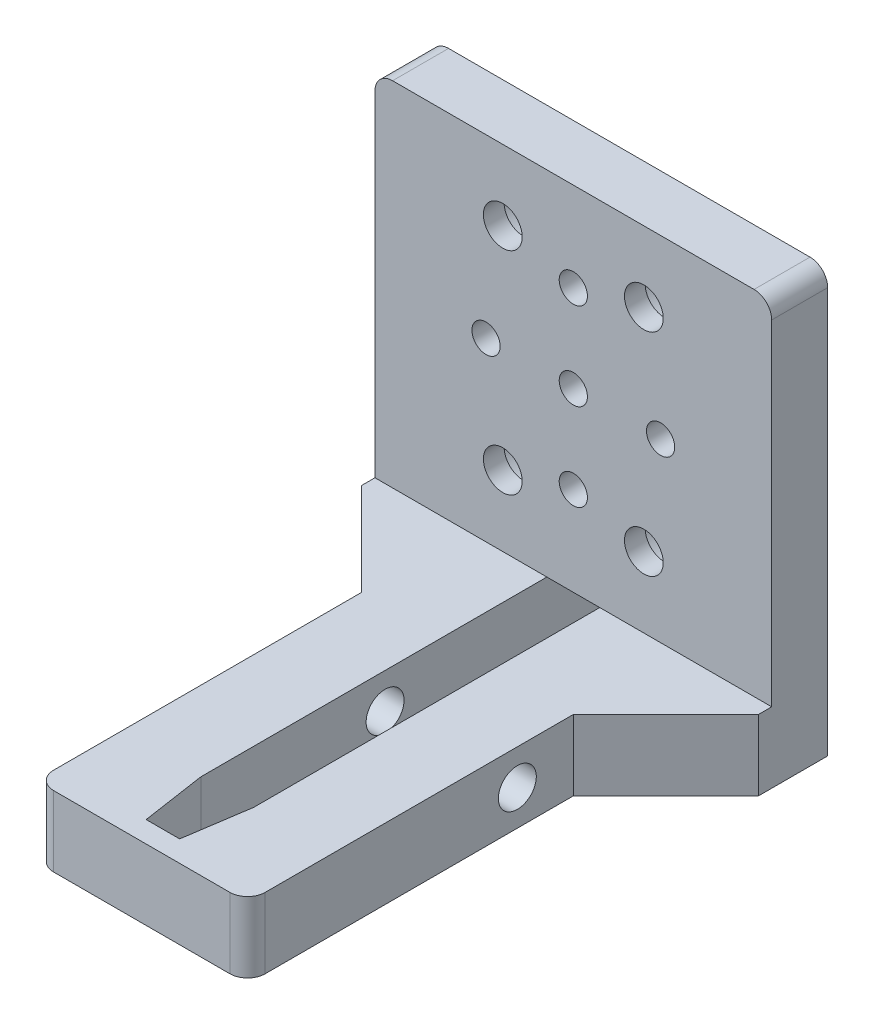
from build123d import *

# Parameters (mm, degrees)
SKETCH1_W                      = 22.5
SKETCH1_H                      = 20
BOSS_EXTRUDE1_DEPTH            = 3.175
TAP_DRILL_FOR_M2X0_4_TAP2_D    = 1.6
BOSS_EXTRUDE2_DEPTH            = 4
CHAMFER1_SIZE                  = 6
M2_CLEARANCE_HOLE1_D           = 2.15
FILLET1_R                      = 1
CBORE_FOR_M2_SHCS1_D           = 2.2
CBORE_FOR_M2_SHCS1_CBORE_D     = 4.4
CBORE_FOR_M2_SHCS1_CBORE_DEPTH = 2


with BuildPart() as part:
    # Sketch1 → Boss-Extrude1 (new body)
    with BuildSketch(Plane.XY):
        Rectangle(SKETCH1_W, SKETCH1_H)
    extrude(amount=BOSS_EXTRUDE1_DEPTH)

    # Tap Drill for M2x0.4 Tap2 (through all)
    with Locations(Plane.XY.offset(3.175)):
        with Locations((0, 0), (-4.949747468, 0), (0, -4.949747468), (4.949747468, 0), (0, 4.949747468)):
            Hole(TAP_DRILL_FOR_M2X0_4_TAP2_D / 2)

    # Sketch10 → Boss-Extrude2 (add)
    with BuildSketch(Plane.XZ.offset(10)):
        Polygon((6, 27.65), (-6, 27.65), (-6, 3.175), (-11.25, 3.175), (-11.25, 0), (-1.5, 0), (-1.5, 22.8), (-0.95, 26.45), (0.95, 26.45), (1.5, 22.8), (1.5, 0), (11.25, 0), (11.25, 3.175), (6, 3.175), align=None)
    extrude(amount=BOSS_EXTRUDE2_DEPTH)

    # Chamfer1
    # the kernel refuses this chamfer: 6 mm, written as the material it adds along each edge
    with BuildSketch(Plane(origin=(-6, -10, 3.175), x_dir=(-0.9996219169112969, 0, -0.02749587661058649), z_dir=(0, -1, 0))) as chamfer1_piece_1_section:
        Polygon((CHAMFER1_SIZE * 0.999621916911, -CHAMFER1_SIZE * 0.0274958766106), (-CHAMFER1_SIZE * 0.0274958766106, -CHAMFER1_SIZE * 0.999621916911), (0, 0), align=None)
    chamfer1_piece_1 = extrude(amount=4, mode=Mode.PRIVATE)
    chamfer1_piece_1 = split(chamfer1_piece_1, bisect_by=Plane(origin=(-11.25, -12, 5.202939), z_dir=(1, 0, 0)), keep=Keep.TOP, mode=Mode.PRIVATE)
    add(chamfer1_piece_1)
    with BuildSketch(Plane(origin=(6, -10, 3.175), x_dir=(0.9996219169112969, 0, -0.02749587661058649), z_dir=(0, -1, 0))) as chamfer1_piece_2_section:
        Polygon((CHAMFER1_SIZE * 0.999621916911, CHAMFER1_SIZE * 0.0274958766106), (-CHAMFER1_SIZE * 0.0274958766106, CHAMFER1_SIZE * 0.999621916911), (0, 0), align=None)
    chamfer1_piece_2 = extrude(amount=4, mode=Mode.PRIVATE)
    chamfer1_piece_2 = split(chamfer1_piece_2, bisect_by=Plane(origin=(11.25, -12, 5.202939), z_dir=(-1, 0, 0)), keep=Keep.TOP, mode=Mode.PRIVATE)
    add(chamfer1_piece_2)

    # M2 Clearance Hole1 (through all)
    with Locations(Plane.ZY.offset(11.25)):
        with Locations((12.35, -12)):
            Hole(M2_CLEARANCE_HOLE1_D / 2)

    # Fillet1
    fillet1_edges = [part.edges().sort_by_distance(p)[0] for p in [
        (6, -12, 27.65),
        (-6, -12, 27.65),
        (-11.25, 10, 1.5875),
        (11.25, 10, 1.5875),
    ]]
    fillet(fillet1_edges, radius=FILLET1_R)

    # CBORE for M2 SHCS1 (through all)
    with Locations(Plane(origin=(0, 0, 0), x_dir=(-1, 0, 0), z_dir=(0, 0, -1))):
        with Locations((4, -6), (-4, 6), (-4, -6), (4, 6)):
            CounterBoreHole(CBORE_FOR_M2_SHCS1_D / 2, CBORE_FOR_M2_SHCS1_CBORE_D / 2, CBORE_FOR_M2_SHCS1_CBORE_DEPTH)


solid = part.part
